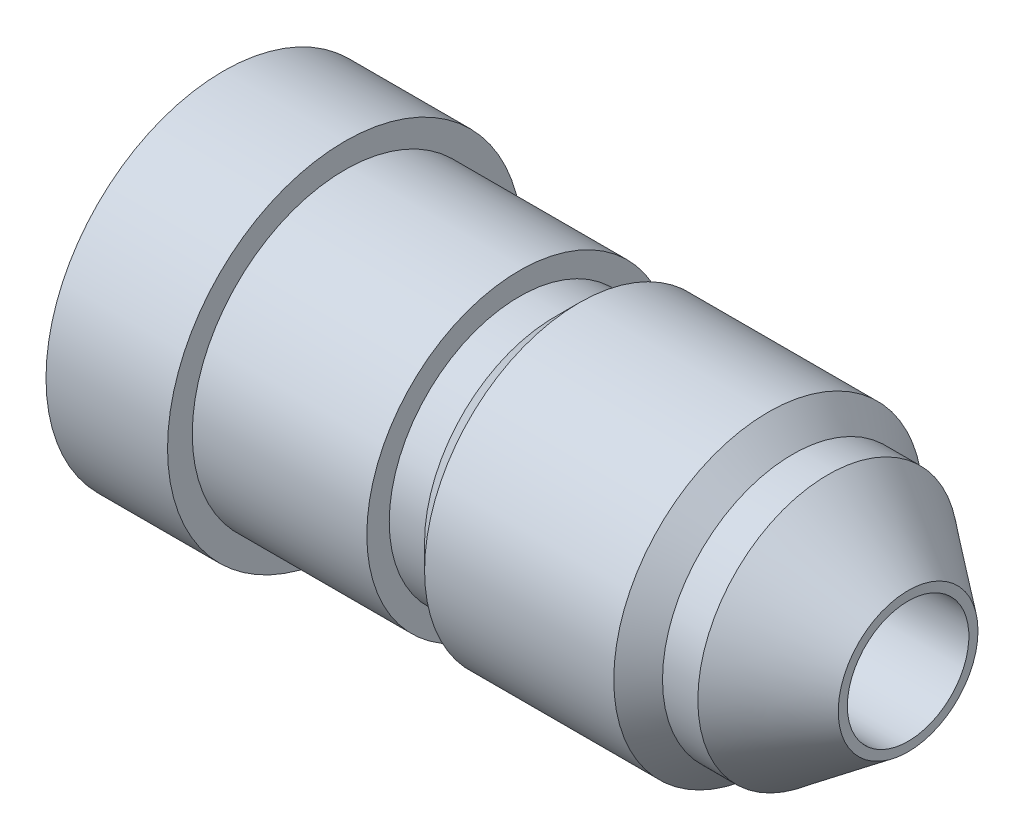
from build123d import *
from build123d.topology import SkipClean

# Parameters (mm, degrees)
CUT_SWEEP1_PITCH = 1.27


with BuildPart() as part:
    # Sketch1 → Revolve1 (revolve)
    with BuildSketch(Plane.XY, mode=Mode.PRIVATE) as revolve1_sk:
        Polygon((-12.3063, 6.3754), (-12.3063, 5.6007), (-7.772716776, 2.1844), (12.3063, 2.1844), (12.3063, 2.51206), (12.3063, 5.55625), (8.266523424, 5.55625), (-1.6637, 5.55625), (-1.6637, 5.4864), (-7.9375, 5.4864), (-7.9375, 6.3754), align=None)
    revolve(revolve1_sk.sketch.rotate(Axis((-12.3063, 0, 0), (1, 0, 0)), 90), axis=Axis((-12.3063, 0, 0), (1, 0, 0)))

    # Cut-Sweep1: the profile of Sketch4 profile screwed along a right-hand helix of 11 turns, 8 arcs to a turn; built about Z, then put on its axis
    cut_sweep1_z = Axis((0, 0, 0), (0, 0, 1))
    cut_sweep1_corners = [(5.55655, 0, 0.000173205), (5.55655, 0, -1.111423205), (4.731360803, 0, -0.635), (4.731360803, 0, -0.47625)]
    with BuildLine(mode=Mode.PRIVATE) as cut_sweep1_profile:
        Line(cut_sweep1_corners[0], cut_sweep1_corners[1])
        Line(cut_sweep1_corners[1], cut_sweep1_corners[2])
        Line(cut_sweep1_corners[2], cut_sweep1_corners[3])
        Line(cut_sweep1_corners[3], cut_sweep1_corners[0])
    cut_sweep1_cap = Face(cut_sweep1_profile.wire())
    cut_sweep1_turn_angles = [0, 22.5, 45, 67.5, 90, 112.5, 135, 157.5, 180, 202.5, 225, 247.5, 270, 292.5, 315, 337.5, 360]
    cut_sweep1_turn_weights = [1, 0.9238795325112867, 1, 0.9238795325112867, 1, 0.9238795325112867, 1, 0.9238795325112867, 1, 0.9238795325112867, 1, 0.9238795325112867, 1, 0.9238795325112867, 1, 0.9238795325112867, 1]
    cut_sweep1_turn_rails = [Edge.make_bspline([Vector(p[0], p[1], 0).rotate(cut_sweep1_z, cut_sweep1_turn_angles[k]) / cut_sweep1_turn_weights[k] + Vector(0, 0, p[2] + CUT_SWEEP1_PITCH * cut_sweep1_turn_angles[k] / 360) for k in range(17)], [0, 0, 0, 1, 1, 2, 2, 3, 3, 4, 4, 5, 5, 6, 6, 7, 7, 8, 8, 8], 2, cut_sweep1_turn_weights) for p in cut_sweep1_corners]
    cut_sweep1_turn_sides = [Face.make_surface_from_curves(cut_sweep1_turn_rails[p[0]], cut_sweep1_turn_rails[p[1]]) for p in [(0, 1), (1, 2), (2, 3), (3, 0)]]
    cut_sweep1_turn = Solid(Shell([*cut_sweep1_turn_sides, cut_sweep1_cap, cut_sweep1_cap.rotate(cut_sweep1_z, 360).moved(Location((0, 0, CUT_SWEEP1_PITCH * 360 / 360)))]))
    cut_sweep1_each = [*[cut_sweep1_turn.moved(Location((0, 0, CUT_SWEEP1_PITCH * i))) for i in range(11)]]
    add(Plane(origin=(12.3063, 0, 0), x_dir=(0, 1, 0), z_dir=(-1, 0, 0)) * Compound([cut_sweep1_each[i] for i in range(0, 11, 2)]), mode=Mode.SUBTRACT)
    add(Plane(origin=(12.3063, 0, 0), x_dir=(0, 1, 0), z_dir=(-1, 0, 0)) * Compound([cut_sweep1_each[i] for i in range(1, 11, 2)]), mode=Mode.SUBTRACT)

    # Sketch5 → Cut-Revolve1 (revolve, cut)
    with BuildSketch(Plane.XY, mode=Mode.PRIVATE) as cut_revolve1_sk:
        Polygon((12.3063, 2.51206), (9.428602239, 4.680560803), (8.158602239, 4.680560803), (7.282913042, 5.55625), (12.3063, 5.55625), align=None)
        Polygon((-1.6637, 5.55625), (-1.6637, 4.680560803), (-0.3937, 4.680560803), (0.481989197, 5.55625), align=None)
    revolve(cut_revolve1_sk.sketch.rotate(Axis((0, 0, 0), (-1, 0, 0)), 90), axis=Axis((0, 0, 0), (-1, 0, 0)), mode=Mode.SUBTRACT)

    # Sketch6 → Revolve2 (revolve)
    with SkipClean():  # the faces are left unmerged after this step: merging them gives an invalid solid
        with BuildSketch(Plane.XY, mode=Mode.PRIVATE) as revolve2_sk:
            Polygon((-0.3937, 4.680560803), (8.158602239, 4.680560803), (7.282913042, 5.55625), (0.481989197, 5.55625), align=None)
        revolve(revolve2_sk.sketch.rotate(Axis((0, 0, 0), (-1, 0, 0)), 90), axis=Axis((0, 0, 0), (-1, 0, 0)))
    add(part.part.scale(1), mode=Mode.REPLACE)  # the faces are merged on a copy


solid = part.part
